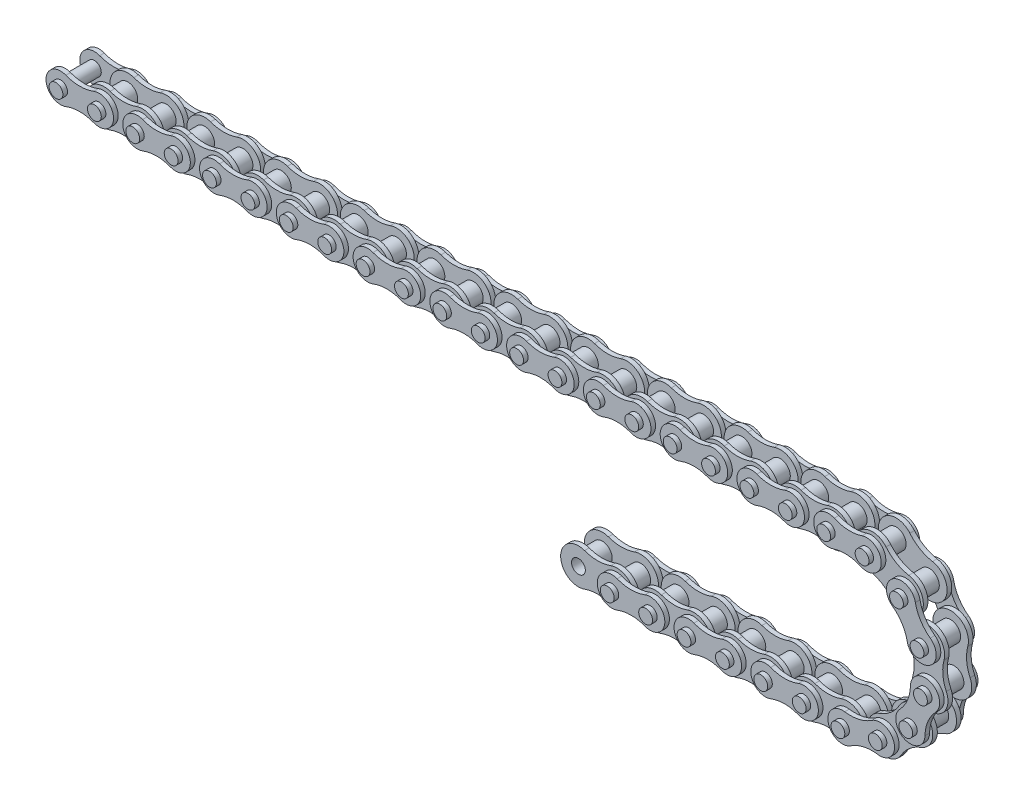
from build123d import *

# Parameters (mm, degrees)
INNER_START             = 1.5875
SKETCH1_R               = 1.143
INNER_LINK_S1_DEPTH     = 0.762
TUBES_START             = 3.175
SKETCH3_R               = 1.651
SKETCH3_R_2             = 1.143
TUBES_DEPTH             = 3.175
OUTER_START             = 3.175
SKETCH4_R               = 1.143
OUTER_LINK_1_DEPTH      = 0.762
SKETCH5_R               = 1.143
PINS_DEPTH              = 3.937
INNER_LINKS_PAT_ANGLE   = 180
INNER_LINKS_PAT_2_ANGLE = 180
INNER_LINKS_PAT_3_ANGLE = 180
INNER_LINKS_PAT_4_ANGLE = 180
INNER_LINKS_PAT_5_ANGLE = 139.8774258
INNER_LINKS_PAT_6_ANGLE = 85.0489286
INNER_LINKS_PAT_7_ANGLE = 30.2204315
OUTER_LINKS_PAT_ANGLE   = 180
OUTER_LINKS_PAT_2_ANGLE = 180
OUTER_LINKS_PAT_3_ANGLE = 180
OUTER_LINKS_PAT_4_ANGLE = 167.2916743
OUTER_LINKS_PAT_5_ANGLE = 112.4631772
OUTER_LINKS_PAT_6_ANGLE = 57.6346801
OUTER_LINKS_PAT_7_ANGLE = 2.8061829


with BuildPart() as part:
    # Sketch1 → inner link s1 (new body)
    with BuildSketch(Plane.XY.offset(INNER_START)):
        with BuildLine():
            ThreePointArc((-1.006284153, -2.769235484), (2.9464, 0), (-1.006284153, 2.769235484))
            ThreePointArc((-1.006284153, 2.769235484), (-3.175, 2.387415405), (-5.343715847, 2.769235484))
            ThreePointArc((-5.343715847, 2.769235484), (-9.2964, 0), (-5.343715847, -2.769235484))
            ThreePointArc((-5.343715847, -2.769235484), (-3.175, -2.387415405), (-1.006284153, -2.769235484))
        make_face()
        with Locations(Location((0, 0, 0), (0, 0, 180))):
            Circle(SKETCH1_R, mode=Mode.SUBTRACT)
        with Locations(Location((-6.35, 0, 0), (0, 0, 180))):
            Circle(SKETCH1_R, mode=Mode.SUBTRACT)
    extrude(amount=INNER_LINK_S1_DEPTH)


with BuildPart() as body_2:
    # inner link s2: mirrored copy
    add(part.part.mirror(Plane.XY))


with BuildPart() as part_1:
    add(part.part)

    add(body_2.part)  # tubes merges body 2
    # Sketch3 → tubes (add)
    # profile 1 of 2: a face of its own
    with BuildSketch(Plane(origin=(0, 0, 1.5875), x_dir=(-1, 0, 0), z_dir=(0, 0, -1)).offset(TUBES_START)):
        with Locations(Location((0, 0, 0), (0, 0, 180))):
            Circle(SKETCH3_R)
        Circle(SKETCH3_R_2, mode=Mode.SUBTRACT)
    # profile 2 of 2: a face of its own
    with BuildSketch(Plane(origin=(0, 0, 1.5875), x_dir=(-1, 0, 0), z_dir=(0, 0, -1)).offset(TUBES_START)):
        with Locations(Location((6.35, 0, 0), (0, 0, 180))):
            Circle(SKETCH3_R)
        with Locations((6.35, 0)):
            Circle(SKETCH3_R_2, mode=Mode.SUBTRACT)
    extrude(amount=-TUBES_DEPTH)


with BuildPart() as body_2_2:
    # Sketch4 → outer link 1 (new body)
    with BuildSketch(Plane.XY.offset(OUTER_START)):
        with BuildLine():
            ThreePointArc((-7.224275362, -2.249046818), (-3.937, 0), (-7.224275362, 2.249046818))
            ThreePointArc((-7.224275362, 2.249046818), (-9.525, 1.817591077), (-11.825724638, 2.249046818))
            ThreePointArc((-11.825724638, 2.249046818), (-15.113, 0), (-11.825724638, -2.249046818))
            ThreePointArc((-11.825724638, -2.249046818), (-9.525, -1.817591077), (-7.224275362, -2.249046818))
        make_face()
        with Locations((-12.7, 0)):
            Circle(SKETCH4_R, mode=Mode.SUBTRACT)
        with Locations(Location((-6.35, 0, 0), (0, 0, 180))):
            Circle(SKETCH4_R, mode=Mode.SUBTRACT)
    extrude(amount=-OUTER_LINK_1_DEPTH)


with BuildPart() as body_3:
    # outer link 2: mirrored copy
    add(body_2_2.part.mirror(Plane.XY))


    add(body_2_2.part)  # pins merges body 2 2
    # Sketch5 → pins (add, symmetric)
    with BuildSketch(Plane.XY):
        with Locations((-12.7, 0)):
            Circle(SKETCH5_R)
        with Locations((-6.35, 0)):
            Circle(SKETCH5_R)
    extrude(amount=PINS_DEPTH, both=True)


with BuildPart() as body_3_2:
    # inner links pat: read off the stored shape, not the designer's step
    # inner links pat: copy of part
    add(part_1.part.moved(Location((-72.1436469, 26.543, 0))).rotate(Axis((0, 0, 0), (0, 0, 1)), INNER_LINKS_PAT_ANGLE))


with BuildPart() as body_4:
    # inner links pat 2: copy of part
    add(part_1.part.moved(Location((-84.8436469, 26.543, 0))).rotate(Axis((0, 0, 0), (0, 0, 1)), INNER_LINKS_PAT_2_ANGLE))


with BuildPart() as body_5:
    # inner links pat 3: copy of part
    add(part_1.part.moved(Location((-97.5436469, 26.543, 0))).rotate(Axis((0, 0, 0), (0, 0, 1)), INNER_LINKS_PAT_3_ANGLE))


with BuildPart() as body_6:
    # inner links pat 4: copy of part
    add(part_1.part.moved(Location((-110.2436469, 26.543, 0))).rotate(Axis((0, 0, 0), (0, 0, 1)), INNER_LINKS_PAT_4_ANGLE))


with BuildPart() as body_7:
    # inner links pat 5: copy of part
    add(part_1.part.moved(Location((-77.604802, 98.7047308, 0))).rotate(Axis((0, 0, 0), (0, 0, -1)), INNER_LINKS_PAT_5_ANGLE))


with BuildPart() as body_8:
    # inner links pat 6: copy of part
    add(part_1.part.moved(Location((26.4795619, 128.5152015, 0))).rotate(Axis((0, 0, 0), (0, 0, -1)), INNER_LINKS_PAT_6_ANGLE))


with BuildPart() as body_9:
    # inner links pat 7: copy of part
    add(part_1.part.moved(Location((110.8028608, 60.604965, 0))).rotate(Axis((0, 0, 0), (0, 0, -1)), INNER_LINKS_PAT_7_ANGLE))


with BuildPart() as body_10:
    # inner links pat 8: copy of part
    add(part_1.part.moved(Location((114.3, 0, 0))))


with BuildPart() as body_11:
    # inner links pat 9: copy of part
    add(part_1.part.moved(Location((101.6, 0, 0))))


with BuildPart() as body_12:
    # inner links pat 10: copy of part
    add(part_1.part.moved(Location((88.9, 0, 0))))


with BuildPart() as body_13:
    # inner links pat 11: copy of part
    add(part_1.part.moved(Location((76.2, 0, 0))))


with BuildPart() as body_14:
    # inner links pat 12: copy of part
    add(part_1.part.moved(Location((63.5, 0, 0))))


with BuildPart() as body_15:
    # inner links pat 13: copy of part
    add(part_1.part.moved(Location((50.8, 0, 0))))


with BuildPart() as body_16:
    # inner links pat 14: copy of part
    add(part_1.part.moved(Location((38.1, 0, 0))))


with BuildPart() as body_17:
    # inner links pat 15: copy of part
    add(part_1.part.moved(Location((25.4, 0, 0))))


with BuildPart() as body_18:
    # inner links pat 16: copy of part
    add(part_1.part.moved(Location((12.7, 0, 0))))


with BuildPart() as body_19:
    # outer links pat: read off the stored shape, not the designer's step
    # outer links pat: copy of body 3
    add(body_3.part.moved(Location((-72.1436469, 26.543, 0))).rotate(Axis((0, 0, 0), (0, 0, 1)), OUTER_LINKS_PAT_ANGLE))


with BuildPart() as body_20:
    # outer links pat 2: copy of body 3
    add(body_3.part.moved(Location((-84.8436469, 26.543, 0))).rotate(Axis((0, 0, 0), (0, 0, 1)), OUTER_LINKS_PAT_2_ANGLE))


with BuildPart() as body_21:
    # outer links pat 3: copy of body 3
    add(body_3.part.moved(Location((-97.5436469, 26.543, 0))).rotate(Axis((0, 0, 0), (0, 0, 1)), OUTER_LINKS_PAT_3_ANGLE))


with BuildPart() as body_22:
    # outer links pat 4: copy of body 3
    add(body_3.part.moved(Location((-101.5185196, 51.9179757, 0))).rotate(Axis((0, 0, 0), (0, 0, -1)), OUTER_LINKS_PAT_4_ANGLE))


with BuildPart() as body_23:
    # outer links pat 5: copy of body 3
    add(body_3.part.moved(Location((-22.8480883, 126.3033384, 0))).rotate(Axis((0, 0, 0), (0, 0, -1)), OUTER_LINKS_PAT_5_ANGLE))


with BuildPart() as body_24:
    # outer links pat 6: copy of body 3
    add(body_3.part.moved(Location((83.2730501, 104.8435397, 0))).rotate(Axis((0, 0, 0), (0, 0, -1)), OUTER_LINKS_PAT_6_ANGLE))


with BuildPart() as body_25:
    # outer links pat 7: copy of body 3
    add(body_3.part.moved(Location((126.8596506, 5.7353805, 0))).rotate(Axis((0, 0, 0), (0, 0, -1)), OUTER_LINKS_PAT_7_ANGLE))


with BuildPart() as body_26:
    # outer links pat 8: copy of body 3
    add(body_3.part.moved(Location((114.3, 0, 0))))


with BuildPart() as body_27:
    # outer links pat 9: copy of body 3
    add(body_3.part.moved(Location((101.6, 0, 0))))


with BuildPart() as body_28:
    # outer links pat 10: copy of body 3
    add(body_3.part.moved(Location((88.9, 0, 0))))


with BuildPart() as body_29:
    # outer links pat 11: copy of body 3
    add(body_3.part.moved(Location((76.2, 0, 0))))


with BuildPart() as body_30:
    # outer links pat 12: copy of body 3
    add(body_3.part.moved(Location((63.5, 0, 0))))


with BuildPart() as body_31:
    # outer links pat 13: copy of body 3
    add(body_3.part.moved(Location((50.8, 0, 0))))


with BuildPart() as body_32:
    # outer links pat 14: copy of body 3
    add(body_3.part.moved(Location((38.1, 0, 0))))


with BuildPart() as body_33:
    # outer links pat 15: copy of body 3
    add(body_3.part.moved(Location((25.4, 0, 0))))


with BuildPart() as body_34:
    # outer links pat 16: copy of body 3
    add(body_3.part.moved(Location((12.7, 0, 0))))


solid = Compound([part_1.part, body_3.part, body_3_2.part, body_4.part, body_5.part, body_6.part, body_7.part, body_8.part, body_9.part, body_10.part, body_11.part, body_12.part, body_13.part, body_14.part, body_15.part, body_16.part, body_17.part, body_18.part, body_19.part, body_20.part, body_21.part, body_22.part, body_23.part, body_24.part, body_25.part, body_26.part, body_27.part, body_28.part, body_29.part, body_30.part, body_31.part, body_32.part, body_33.part, body_34.part])
